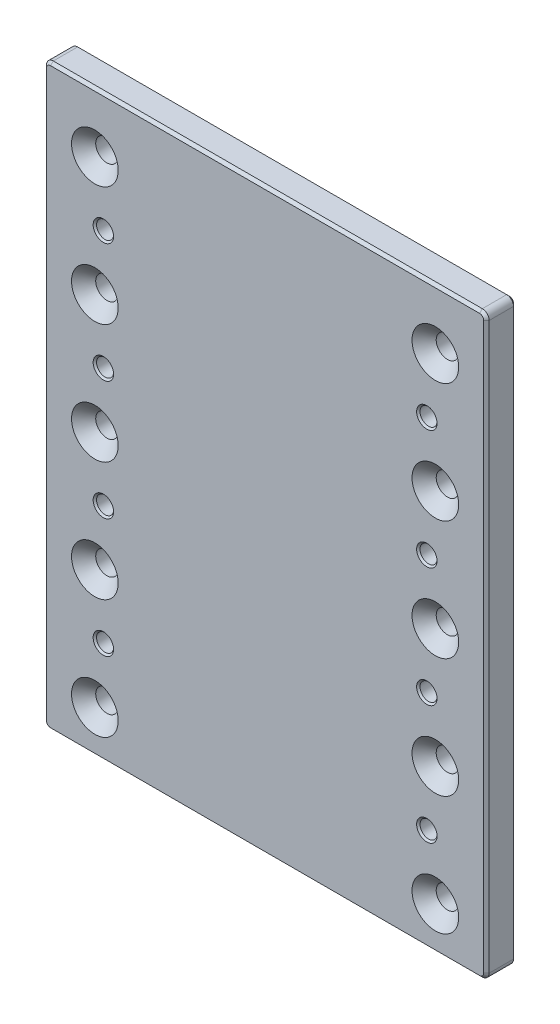
from build123d import *

# Parameters (mm, degrees)
BASE_FLANGE1_START                           = -4.375
BASE_FLANGE1_OUTLINE_W                       = 130
BASE_FLANGE1_OUTLINE_H                       = 170
BASE_FLANGE1_DEPTH                           = 8.75
M6_TAPPED_HOLE1_AT_2_COUNT                   = 2
M6_TAPPED_HOLE1_AT_2_PITCH                   = 105
M6_TAPPED_HOLE1_AT_3_COUNT                   = 2
M6_TAPPED_HOLE1_AT_3_PITCH                   = 70
M6_TAPPED_HOLE1_AT_4_COUNT                   = 2
M6_TAPPED_HOLE1_AT_4_PITCH                   = 35
CSK_FOR_M6_HEX_SOCKET_COUNTERSUNK_HE_2_COUNT = 2
CSK_FOR_M6_HEX_SOCKET_COUNTERSUNK_HE_2_PITCH = 35
CSK_FOR_M6_HEX_SOCKET_COUNTERSUNK_HE_3_COUNT = 2
CSK_FOR_M6_HEX_SOCKET_COUNTERSUNK_HE_3_PITCH = 70
CSK_FOR_M6_HEX_SOCKET_COUNTERSUNK_HE_4_COUNT = 2
CSK_FOR_M6_HEX_SOCKET_COUNTERSUNK_HE_4_PITCH = 105
CSK_FOR_M6_HEX_SOCKET_COUNTERSUNK_HE_5_COUNT = 2
CSK_FOR_M6_HEX_SOCKET_COUNTERSUNK_HE_5_PITCH = 140
FILLET1_R                                    = 2
CHAMFER1_SIZE                                = 0.8


# Read off the part's stored shape, not the designer's step: Base-Flange1
with BuildPart() as part:
    # Base-Flange1 outline → Base-Flange1 (new body)
    with BuildSketch(Plane.XY.offset(BASE_FLANGE1_START)):
        Rectangle(BASE_FLANGE1_OUTLINE_W, BASE_FLANGE1_OUTLINE_H)
    extrude(amount=BASE_FLANGE1_DEPTH)

    # Sketch8 → M6 Tapped Hole1 (revolve, cut)
    with BuildSketch(Plane(origin=(-47.5, -55, 4.375), x_dir=(0, -1, 0), z_dir=(1, 0, 0))):
        Polygon((0, 0), (0, 8.75), (3, 8.75), (2.5, 8.25), (2.5, 0.5), (3, 0), align=None)
    m6_tapped_hole1 = revolve(axis=Axis((-47.5, -55, 10.725), (0, 0, -1)), mode=Mode.SUBTRACT)

    # M6 Tapped Hole1 at 2: M6 Tapped Hole1 ×2
    with Locations(*[(0, i * M6_TAPPED_HOLE1_AT_2_PITCH, 0) for i in range(1, M6_TAPPED_HOLE1_AT_2_COUNT)]):
        add(m6_tapped_hole1, mode=Mode.SUBTRACT)

    # M6 Tapped Hole1 at 3: M6 Tapped Hole1 ×2
    with Locations(*[(0, i * M6_TAPPED_HOLE1_AT_3_PITCH, 0) for i in range(1, M6_TAPPED_HOLE1_AT_3_COUNT)]):
        add(m6_tapped_hole1, mode=Mode.SUBTRACT)

    # M6 Tapped Hole1 at 4: M6 Tapped Hole1 ×2
    with Locations(*[(0, i * M6_TAPPED_HOLE1_AT_4_PITCH, 0) for i in range(1, M6_TAPPED_HOLE1_AT_4_COUNT)]):
        add(m6_tapped_hole1, mode=Mode.SUBTRACT)

    # Sketch12 → CSK for M6 Hex Socket Countersunk Head Screw1 (revolve, cut)
    with BuildSketch(Plane(origin=(-50, -72.5, 4.375), x_dir=(0, -1, 0), z_dir=(1, 0, 0))):
        Polygon((0, 0), (0, 8.75), (3.5, 8.75), (3.3, 8.55), (3.3, 3.555), (6.855, 0), align=None)
    csk_for_m6_hex_socket_countersunk_head_s = revolve(axis=Axis((-50, -72.5, 10.725), (0, 0, -1)), mode=Mode.SUBTRACT)

    # CSK for M6 Hex Socket Countersunk He 2: CSK for M6 Hex Socket Countersunk Head Screw1 ×2
    with Locations(*[(0, i * CSK_FOR_M6_HEX_SOCKET_COUNTERSUNK_HE_2_PITCH, 0) for i in range(1, CSK_FOR_M6_HEX_SOCKET_COUNTERSUNK_HE_2_COUNT)]):
        add(csk_for_m6_hex_socket_countersunk_head_s, mode=Mode.SUBTRACT)

    # CSK for M6 Hex Socket Countersunk He 3: CSK for M6 Hex Socket Countersunk Head Screw1 ×2
    with Locations(*[(0, i * CSK_FOR_M6_HEX_SOCKET_COUNTERSUNK_HE_3_PITCH, 0) for i in range(1, CSK_FOR_M6_HEX_SOCKET_COUNTERSUNK_HE_3_COUNT)]):
        add(csk_for_m6_hex_socket_countersunk_head_s, mode=Mode.SUBTRACT)

    # CSK for M6 Hex Socket Countersunk He 4: CSK for M6 Hex Socket Countersunk Head Screw1 ×2
    with Locations(*[(0, i * CSK_FOR_M6_HEX_SOCKET_COUNTERSUNK_HE_4_PITCH, 0) for i in range(1, CSK_FOR_M6_HEX_SOCKET_COUNTERSUNK_HE_4_COUNT)]):
        add(csk_for_m6_hex_socket_countersunk_head_s, mode=Mode.SUBTRACT)

    # CSK for M6 Hex Socket Countersunk He 5: CSK for M6 Hex Socket Countersunk Head Screw1 ×2
    with Locations(*[(0, i * CSK_FOR_M6_HEX_SOCKET_COUNTERSUNK_HE_5_PITCH, 0) for i in range(1, CSK_FOR_M6_HEX_SOCKET_COUNTERSUNK_HE_5_COUNT)]):
        add(csk_for_m6_hex_socket_countersunk_head_s, mode=Mode.SUBTRACT)

    # Mirror1: M6 Tapped Hole1, CSK for M6 Hex Socket Countersunk Head Screw1 across plane
    add(m6_tapped_hole1.mirror(Plane(origin=(0, 0, 0), x_dir=(0, 0, 1), z_dir=(1, 0, 0))), mode=Mode.SUBTRACT)
    add(csk_for_m6_hex_socket_countersunk_head_s.mirror(Plane(origin=(0, 0, 0), x_dir=(0, 0, 1), z_dir=(1, 0, 0))), mode=Mode.SUBTRACT)

    # Mirror1 copy 1 sketch → Mirror1 copy 1 (revolve, cut)
    with BuildSketch(Plane(origin=(47.5, 50, 4.375), x_dir=(0, -1, 0), z_dir=(-1, 0, 0))):
        Polygon((0, 0), (0, -8.75), (3, -8.75), (2.5, -8.25), (2.5, -0.5), (3, 0), align=None)
    revolve(axis=Axis((47.5, 50, 10.725), (0, 0, 1)), mode=Mode.SUBTRACT)

    # Mirror1 copy 2 sketch → Mirror1 copy 2 (revolve, cut)
    with BuildSketch(Plane(origin=(47.5, 15, 4.375), x_dir=(0, -1, 0), z_dir=(-1, 0, 0))):
        Polygon((0, 0), (0, -8.75), (3, -8.75), (2.5, -8.25), (2.5, -0.5), (3, 0), align=None)
    revolve(axis=Axis((47.5, 15, 10.725), (0, 0, 1)), mode=Mode.SUBTRACT)

    # Mirror1 copy 3 sketch → Mirror1 copy 3 (revolve, cut)
    with BuildSketch(Plane(origin=(47.5, -20, 4.375), x_dir=(0, -1, 0), z_dir=(-1, 0, 0))):
        Polygon((0, 0), (0, -8.75), (3, -8.75), (2.5, -8.25), (2.5, -0.5), (3, 0), align=None)
    revolve(axis=Axis((47.5, -20, 10.725), (0, 0, 1)), mode=Mode.SUBTRACT)

    # Mirror1 copy 4 sketch → Mirror1 copy 4 (revolve, cut)
    with BuildSketch(Plane(origin=(50, -37.5, 4.375), x_dir=(0, -1, 0), z_dir=(-1, 0, 0))):
        Polygon((0, 0), (0, -8.75), (3.5, -8.75), (3.3, -8.55), (3.3, -3.555), (6.855, 0), align=None)
    revolve(axis=Axis((50, -37.5, 10.725), (0, 0, 1)), mode=Mode.SUBTRACT)

    # Mirror1 copy 5 sketch → Mirror1 copy 5 (revolve, cut)
    with BuildSketch(Plane(origin=(50, -2.5, 4.375), x_dir=(0, -1, 0), z_dir=(-1, 0, 0))):
        Polygon((0, 0), (0, -8.75), (3.5, -8.75), (3.3, -8.55), (3.3, -3.555), (6.855, 0), align=None)
    revolve(axis=Axis((50, -2.5, 10.725), (0, 0, 1)), mode=Mode.SUBTRACT)

    # Mirror1 copy 6 sketch → Mirror1 copy 6 (revolve, cut)
    with BuildSketch(Plane(origin=(50, 32.5, 4.375), x_dir=(0, -1, 0), z_dir=(-1, 0, 0))):
        Polygon((0, 0), (0, -8.75), (3.5, -8.75), (3.3, -8.55), (3.3, -3.555), (6.855, 0), align=None)
    revolve(axis=Axis((50, 32.5, 10.725), (0, 0, 1)), mode=Mode.SUBTRACT)

    # Mirror1 copy 7 sketch → Mirror1 copy 7 (revolve, cut)
    with BuildSketch(Plane(origin=(50, 67.5, 4.375), x_dir=(0, -1, 0), z_dir=(-1, 0, 0))):
        Polygon((0, 0), (0, -8.75), (3.5, -8.75), (3.3, -8.55), (3.3, -3.555), (6.855, 0), align=None)
    revolve(axis=Axis((50, 67.5, 10.725), (0, 0, 1)), mode=Mode.SUBTRACT)

    # Fillet1
    fillet1_edges = [part.edges().sort_by_distance(p)[0] for p in [
        (-65, 85, 0),
        (65, 85, 0),
        (65, -85, 0),
        (-65, -85, 0),
    ]]
    fillet(fillet1_edges, radius=FILLET1_R)

    # Chamfer1
    chamfer1_edges = [part.edges().sort_by_distance(p)[0] for p in [
        (65, 0, 4.375),
        (65, 0, -4.375),
        (-65, 0, 4.375),
        (0, -85, 4.375),
        (0, 85, 4.375),
        (-64.414213562, 84.414213562, 4.375),
        (-64.414213562, -84.414213562, 4.375),
        (64.414213562, -84.414213562, 4.375),
        (64.414213562, 84.414213562, 4.375),
        (0, 85, -4.375),
        (-65, 0, -4.375),
        (0, -85, -4.375),
        (-64.414213562, 84.414213562, -4.375),
        (-64.414213562, -84.414213562, -4.375),
        (64.414213562, -84.414213562, -4.375),
        (64.414213562, 84.414213562, -4.375),
    ]]
    chamfer(chamfer1_edges, length=CHAMFER1_SIZE)


solid = part.part
